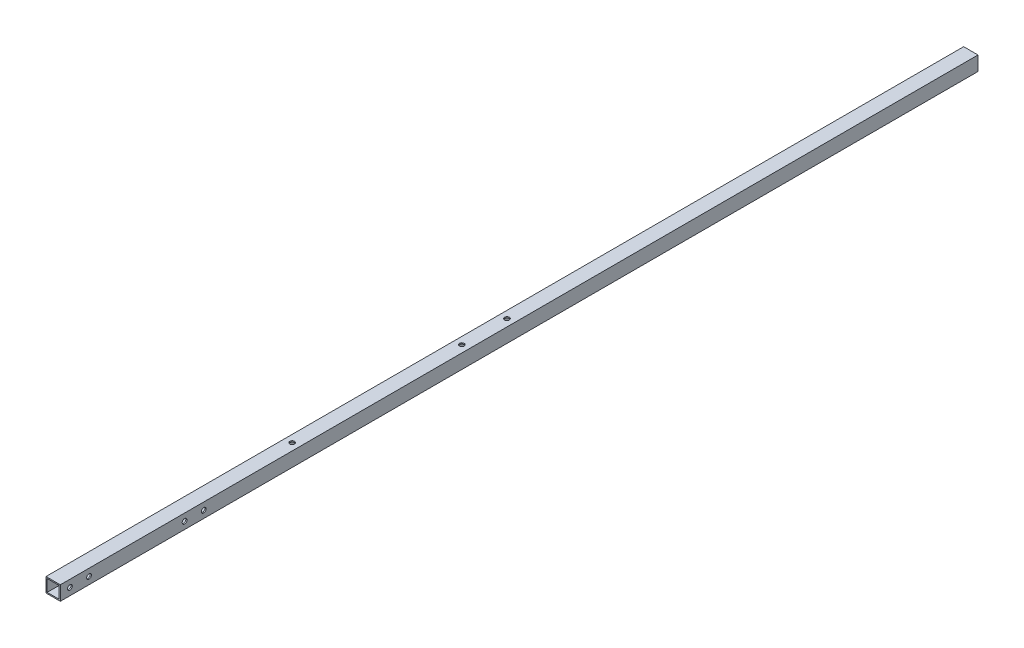
from build123d import *

# Parameters (mm, degrees)
SKETCH1_W               = 19.05
SKETCH1_H               = 19.05
SKETCH1_W_2             = 15.875
SKETCH1_H_2             = 15.875
BOSS_EXTRUDE1_DEPTH     = 609.6
SKETCH3_R               = 3.175
CUT_EXTRUDE1_DEPTH      = 610.971956835
SKETCH4_R               = 3.175
CUT_EXTRUDE2_DEPTH      = 610.971956835
CUT_EXTRUDE4_DEPTH      = 610.971956835
CUT_EXTRUDE4_DEPTH_BACK = 610.971956835
SKETCH7_R               = 3.175
SKETCH8_R               = 3.175
CUT_EXTRUDE5_DEPTH      = 610.971956835


with BuildPart() as part:
    # Sketch1 → Boss-Extrude1 (new, symmetric)
    with BuildSketch(Plane.XY):
        Rectangle(SKETCH1_W, SKETCH1_H)
        Rectangle(SKETCH1_W_2, SKETCH1_H_2, mode=Mode.SUBTRACT)
    extrude(amount=BOSS_EXTRUDE1_DEPTH, both=True)

    # Sketch3 → Cut-Extrude1 (cut, through all)
    with BuildSketch(Plane(origin=(9.525, 0, 0), x_dir=(0, 0, -1), z_dir=(1, 0, 0))):
        with Locations((-571.5, 0)):
            Circle(SKETCH3_R)
        with Locations((-596.9, 0)):
            Circle(SKETCH3_R)
    extrude(amount=-CUT_EXTRUDE1_DEPTH, mode=Mode.SUBTRACT)

    # Sketch4 → Cut-Extrude2 (cut, through all)
    with BuildSketch(Plane.ZY.offset(9.525)):
        with Locations((444.5, 0)):
            Circle(SKETCH4_R)
        with Locations((419.1, 0)):
            Circle(SKETCH4_R)
    extrude(amount=-CUT_EXTRUDE2_DEPTH, mode=Mode.SUBTRACT)

    # Sketch7 → Cut-Extrude4 (cut, two sides: drawn at the far end of the back side and taken through both)
    with BuildSketch(Plane.XZ.offset(9.525).offset(-CUT_EXTRUDE4_DEPTH_BACK)):
        with Locations((0, 292.1)):
            Circle(SKETCH7_R)
        with Locations((0, 66.675)):
            Circle(SKETCH7_R)
    extrude(amount=CUT_EXTRUDE4_DEPTH + CUT_EXTRUDE4_DEPTH_BACK, mode=Mode.SUBTRACT)

    # Sketch8 → Cut-Extrude5 (cut, through all)
    with BuildSketch(Plane(origin=(0, 9.525, 0), x_dir=(1, 0, 0), z_dir=(0, 1, 0))):
        with Locations((0, -6.675)):
            Circle(SKETCH8_R)
    extrude(amount=-CUT_EXTRUDE5_DEPTH, mode=Mode.SUBTRACT)


solid = part.part
